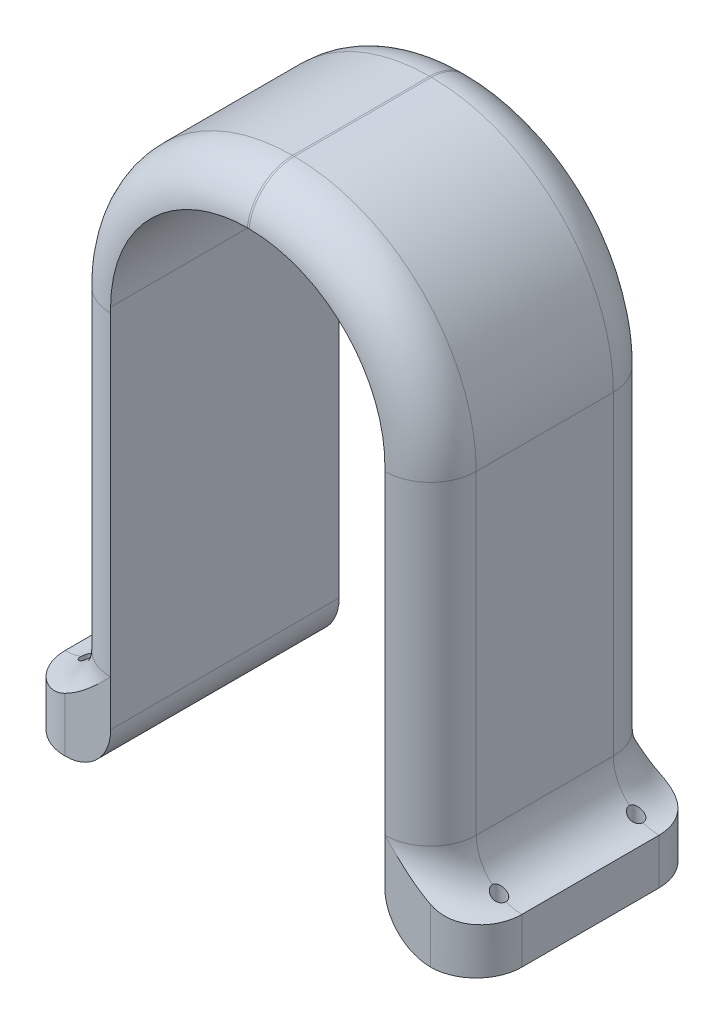
from build123d import *

# Parameters (mm, degrees)
BOSS_EXTRUDE2_DEPTH = 50
SKETCH3_R           = 1.5
SKETCH3_R_2         = 1.5000000000000002
SKETCH3_R_3         = 1.4999999999999973
CUT_EXTRUDE1_DEPTH  = 50
FILLET2_R           = 10
FILLET3_R           = 10
FILLET8_R           = 10
FILLET12_R          = 10
FILLET13_R          = 10
FILLET14_R          = 10
FILLET15_R          = 10
FILLET16_R          = 10
FILLET19_R          = 10


# Some blends are built 0.0001 mm under size
with BuildPart() as part:
    # Sketch1 → Boss-Extrude2 (new body)
    with BuildSketch(Plane.XY):
        with BuildLine():
            Line((-7.452830188679244, -1.2358490566037745), (-7.452830188679242, -11.235849056603774))
            Line((-7.452830188679242, -11.235849056603774), (12.547169811320757, -11.235849056603774))
            Line((12.547169811320757, -11.235849056603774), (12.547169811320757, 78.86415094339623))
            ThreePointArc((12.547169811320757, 78.86415094339623), (21.304677053842983, 100.00664370087401), (42.447169811320755, 108.76415094339623))
            Line((42.447169811320755, 108.76415094339623), (42.647169811320765, 108.76415094339623))
            ThreePointArc((42.647169811320765, 108.76415094339623), (63.78966256879854, 100.00664370087402), (72.54716981132077, 78.86415094339624))
            Line((72.54716981132077, 78.86415094339624), (72.54716981132076, -11.235849056603778))
            Line((72.54716981132076, -11.235849056603778), (92.54716981132076, -11.235849056603774))
            Line((92.54716981132076, -11.235849056603774), (92.54716981132076, -1.2358490566037745))
            Line((92.54716981132076, -1.2358490566037745), (82.54716981132077, -1.2358490566037745))
            Line((82.54716981132077, -1.2358490566037745), (82.54716981132077, 77.70413150101334))
            ThreePointArc((82.54716981132077, 77.70413150101334), (70.89001970254536, 105.84698139223794), (42.74716981132076, 117.50413150101335))
            Line((42.74716981132076, 117.50413150101335), (42.34716981132076, 117.50413150101332))
            ThreePointArc((42.34716981132076, 117.50413150101332), (14.204319920096182, 105.84698139223792), (2.5471698113207557, 77.70413150101334))
            Line((2.5471698113207557, 77.70413150101334), (2.5471698113207566, -1.2358490566037745))
            Line((2.5471698113207566, -1.2358490566037745), (-7.452830188679244, -1.2358490566037745))
        make_face()
    extrude(amount=BOSS_EXTRUDE2_DEPTH)

    # Sketch3 → Cut-Extrude1 (cut)
    with BuildSketch(Plane(origin=(0, -1.2358490566037745, 0), x_dir=(1, 0, 0), z_dir=(0, 1, 0))):
        with Locations(Location((-2.4528301886792443, -40, 0), (0, 0, 270))):
            Circle(SKETCH3_R)
        with Locations(Location((-2.452830188679243, -9.999999999999998, 0), (0, 0, 270))):
            Circle(SKETCH3_R_2)
        with Locations(Location((87.54716981132077, -9.999999999999998, 0), (0, 0, 270))):
            Circle(SKETCH3_R_3)
        with Locations(Location((87.54716981132077, -40, 0), (0, 0, 270))):
            Circle(SKETCH3_R_3)
    extrude(amount=-CUT_EXTRUDE1_DEPTH, mode=Mode.SUBTRACT)

    # Fillet2
    fillet2_edges = [part.edges().sort_by_distance(p)[0] for p in [
        (12.547169811320757, -11.235849056603774, 25),
    ]]
    fillet(fillet2_edges, radius=FILLET2_R)

    # Fillet3
    fillet3_edges = [part.edges().sort_by_distance(p)[0] for p in [
        (72.54716981132076, -11.235849056603778, 25),
    ]]
    fillet(fillet3_edges, radius=FILLET3_R)

    # Fillet8
    # the kernel refuses this fillet: 10 mm, written as the material it takes off along each edge
    with BuildSketch(Plane(origin=(82.54716981132077, -1.2358490566037745, 50), x_dir=(0, 0, -1), z_dir=(0, 1, 0))) as fillet8_piece_1:
        with BuildLine():
            CenterArc((FILLET8_R, FILLET8_R), FILLET8_R, 180, 90)
            Line((0, FILLET8_R), (0, 0))
            Line((0, 0), (FILLET8_R, 0))
        make_face()
    extrude(amount=78.9399805576171, mode=Mode.SUBTRACT)
    with BuildSketch(Plane(origin=(2.5471698113207557, 77.70413150101334, 50), x_dir=(9e-17, 0, -1), z_dir=(1e-17, -1, 0))) as fillet8_piece_2:
        with BuildLine():
            CenterArc((FILLET8_R, FILLET8_R), FILLET8_R, 180, 90)
            Line((8.9e-16, FILLET8_R), (0, 0))
            Line((0, 0), (FILLET8_R, 0))
        make_face()
    extrude(amount=78.9399805576171, mode=Mode.SUBTRACT)
    with BuildSketch(Plane(origin=(42.34716981132078, 77.70413150101331, 50), x_dir=(-5.4e-16, 1, 0), z_dir=(1, 5.4e-16, 0))) as fillet8_piece_3:
        with BuildLine():
            CenterArc((39.80000000000001 - FILLET8_R, -FILLET8_R), FILLET8_R, 0, 90)
            Line((39.80000000000001 - FILLET8_R, 0), (39.80000000000001, 0))
            Line((39.80000000000001, 0), (39.80000000000001, -FILLET8_R))
        make_face()
    revolve(axis=Axis((42.34716981132078, 77.70413150101331, 50), (0, 0, 1)), revolution_arc=89.99999999999993, mode=Mode.SUBTRACT)
    with BuildSketch(Plane(origin=(82.54716981132077, -1.2358490566037745, 0), x_dir=(-1, 0, 0), z_dir=(0, 1, 0))) as fillet8_piece_4:
        with BuildLine():
            CenterArc((FILLET8_R, FILLET8_R), FILLET8_R, 180, 90)
            Line((0, FILLET8_R), (0, 0))
            Line((0, 0), (FILLET8_R, 0))
        make_face()
    extrude(amount=78.9399805576171, mode=Mode.SUBTRACT)
    with BuildSketch(Plane(origin=(2.5471698113207557, 77.70413150101334, 0), x_dir=(1, 1e-17, 0), z_dir=(1e-17, -1, 0))) as fillet8_piece_5:
        with BuildLine():
            CenterArc((FILLET8_R, FILLET8_R), FILLET8_R, 180, 90)
            Line((-2.66e-15, FILLET8_R), (0, 0))
            Line((0, 0), (FILLET8_R, 0))
        make_face()
    extrude(amount=78.9399805576171, mode=Mode.SUBTRACT)
    with BuildSketch(Plane(origin=(42.34716981132078, 77.70413150101331, 0), x_dir=(-5.4e-16, 1, 0), z_dir=(1, 5.4e-16, 0))) as fillet8_piece_6:
        with BuildLine():
            CenterArc((39.80000000000001 - FILLET8_R, FILLET8_R), FILLET8_R, 270, 89.99999999999999)
            Line((39.80000000000001, FILLET8_R), (39.80000000000001, 0))
            Line((39.80000000000001, 0), (39.80000000000001 - FILLET8_R, 0))
        make_face()
    revolve(axis=Axis((42.34716981132078, 77.70413150101331, 0), (0, 0, 1)), revolution_arc=89.99999999999993, mode=Mode.SUBTRACT)
    with BuildSketch(Plane(origin=(42.74716981132076, 77.70413150101334, 50), x_dir=(1, 0, 0), z_dir=(0, -1, 0))) as fillet8_piece_7:
        with BuildLine():
            CenterArc((39.80000000000001 - FILLET8_R, -FILLET8_R), FILLET8_R, 0, 90)
            Line((39.80000000000001 - FILLET8_R, 0), (39.80000000000001, 0))
            Line((39.80000000000001, 0), (39.80000000000001, -FILLET8_R))
        make_face()
    revolve(axis=Axis((42.74716981132076, 77.70413150101334, 50), (0, 0, 1)), revolution_arc=90, mode=Mode.SUBTRACT)
    with BuildSketch(Plane(origin=(42.74716981132076, 77.70413150101334, 0), x_dir=(1, 0, 0), z_dir=(0, -1, 0))) as fillet8_piece_8:
        with BuildLine():
            CenterArc((39.80000000000001 - FILLET8_R, FILLET8_R), FILLET8_R, 270, 89.99999999999999)
            Line((39.80000000000001, FILLET8_R), (39.80000000000001, 0))
            Line((39.80000000000001, 0), (39.80000000000001 - FILLET8_R, 0))
        make_face()
    revolve(axis=Axis((42.74716981132076, 77.70413150101334, 0), (0, 0, 1)), revolution_arc=90, mode=Mode.SUBTRACT)
    with BuildSketch(Plane(origin=(42.74716981132076, 117.50413150101335, 0), x_dir=(7.105e-14, -1, 0), z_dir=(-1, -7.105e-14, 0))) as fillet8_piece_9:
        with BuildLine():
            CenterArc((FILLET8_R, FILLET8_R), FILLET8_R, 180, 90)
            Line((0, FILLET8_R), (0, 0))
            Line((0, 0), (FILLET8_R, 0))
        make_face()
    extrude(amount=0.3999999999999986, mode=Mode.SUBTRACT)
    with BuildSketch(Plane(origin=(42.74716981132076, 117.50413150101335, 50), x_dir=(0, 0, -1), z_dir=(-1, -7.105e-14, 0))) as fillet8_piece_10:
        with BuildLine():
            CenterArc((FILLET8_R, FILLET8_R), FILLET8_R, 180, 90)
            Line((0, FILLET8_R), (0, 0))
            Line((0, 0), (FILLET8_R, 0))
        make_face()
    extrude(amount=0.3999999999999986, mode=Mode.SUBTRACT)

    # Fillet12
    # the kernel refuses this fillet: 10 mm, written as the material it adds along each edge
    with BuildSketch(Plane(origin=(72.547169811321, -1.235849056604, 10), x_dir=(1, 0, 1.8e-16), z_dir=(-1.8e-16, 0, 1))) as fillet12_piece_1_section:
        with BuildLine():
            CenterArc((10 + FILLET12_R, FILLET12_R), FILLET12_R, 180, 90)
            Line((10 + FILLET12_R, -1.55e-15), (10, 0))
            Line((10, 0), (10, FILLET12_R))
        make_face()
    fillet12_piece_1 = revolve(axis=Axis((72.547169811321, -1.235849056604, 10), (0, 1, 0)), revolution_arc=90, mode=Mode.PRIVATE)
    fillet12_piece_1 = split(fillet12_piece_1, bisect_by=Plane(origin=(75.00369430910867, 6.370618904559798, 0), z_dir=(0, 0, 1)), keep=Keep.TOP, mode=Mode.PRIVATE)
    fillet12_piece_1 = fillet12_piece_1 - Plane(origin=(87.54716981132077, 6.370618904559796, 9.999999999999998), x_dir=(-1.8e-16, 0, 1), z_dir=(0, 1, 0)) * Cylinder(1.4999999999999973, 80, mode=Mode.PRIVATE)
    add(fillet12_piece_1)
    with BuildSketch(Plane(origin=(82.54716981132077, -1.2358490566037745, 10), x_dir=(0, 1, 0), z_dir=(0, 0, 1))) as fillet12_piece_2_section:
        with BuildLine():
            CenterArc((FILLET12_R, -FILLET12_R), FILLET12_R, 90, 90)
            Line((-1.33e-15, -FILLET12_R), (0, 0))
            Line((0, 0), (FILLET12_R, 0))
        make_face()
    fillet12_piece_2 = extrude(amount=30, mode=Mode.PRIVATE)
    fillet12_piece_2 = fillet12_piece_2 - Plane(origin=(87.54716981132077, 1.0205377803121847, 40), x_dir=(-1.8e-16, 0, 1), z_dir=(0, 1, 0)) * Cylinder(1.4999999999999973, 100, mode=Mode.PRIVATE)
    fillet12_piece_2 = fillet12_piece_2 - Plane(origin=(87.54716981132077, 1.0205377803121847, 9.999999999999998), x_dir=(-1.8e-16, 0, 1), z_dir=(0, 1, 0)) * Cylinder(1.4999999999999973, 100, mode=Mode.PRIVATE)
    add(fillet12_piece_2)
    with BuildSketch(Plane(origin=(72.547169811321, -1.235849056604, 40), x_dir=(0, 0, 1), z_dir=(-1, 0, 0))) as fillet12_piece_3_section:
        with BuildLine():
            CenterArc((10 + FILLET12_R, FILLET12_R), FILLET12_R, 180, 90)
            Line((10 + FILLET12_R, -1.55e-15), (10, 0))
            Line((10, 0), (10, FILLET12_R))
        make_face()
    fillet12_piece_3 = revolve(axis=Axis((72.547169811321, -1.235849056604, 40), (0, 1, 0)), revolution_arc=90, mode=Mode.PRIVATE)
    fillet12_piece_3 = split(fillet12_piece_3, bisect_by=Plane(origin=(75.00426840163993, 6.370343731696096, 50), z_dir=(0, 0, -1)), keep=Keep.TOP, mode=Mode.PRIVATE)
    fillet12_piece_3 = fillet12_piece_3 - Plane(origin=(87.54716981132077, 6.370343731696099, 40), x_dir=(-1.8e-16, 0, 1), z_dir=(0, 1, 0)) * Cylinder(1.4999999999999973, 80, mode=Mode.PRIVATE)
    add(fillet12_piece_3)

    # Fillet13
    # the kernel refuses this fillet: 10 mm, written as the material it adds along each edge
    with BuildSketch(Plane(origin=(12.547169811321, -1.2358490566040103, 10), x_dir=(-1, 0, 1.8e-16), z_dir=(1.8e-16, 0, 1))) as fillet13_piece_1_section:
        with BuildLine():
            CenterArc((10 + FILLET13_R, -FILLET13_R), FILLET13_R, 90, 90)
            Line((10 + FILLET13_R, 0), (10, 0))
            Line((10, 0), (10, -FILLET13_R))
        make_face()
    fillet13_piece_1 = revolve(axis=Axis((12.547169811321, -1.2358490566040103, 10), (0, -1, 0)), revolution_arc=90, mode=Mode.PRIVATE)
    fillet13_piece_1 = split(fillet13_piece_1, bisect_by=Plane(origin=(10.086939515151748, 6.369976518632988, 0), z_dir=(0, 0, 1)), keep=Keep.TOP, mode=Mode.PRIVATE)
    fillet13_piece_1 = fillet13_piece_1 - Plane(origin=(-2.452830188679243, 6.369976518632987, 9.999999999999998), x_dir=(-1.8e-16, 0, 1), z_dir=(0, 1, 0)) * Cylinder(1.5000000000000002, 80, mode=Mode.PRIVATE)
    add(fillet13_piece_1)
    with BuildSketch(Plane(origin=(2.5471698113207566, -1.2358490566037745, 10), x_dir=(0, 1, 0), z_dir=(0, 0, 1))) as fillet13_piece_2_section:
        with BuildLine():
            CenterArc((FILLET13_R, FILLET13_R), FILLET13_R, 180, 90)
            Line((5.77e-15, FILLET13_R), (0, 0))
            Line((0, 0), (FILLET13_R, 0))
        make_face()
    fillet13_piece_2 = extrude(amount=30, mode=Mode.PRIVATE)
    fillet13_piece_2 = fillet13_piece_2 - Plane(origin=(-2.452830188679243, 1.0205357835469981, 9.999999999999998), x_dir=(-1.8e-16, 0, 1), z_dir=(0, 1, 0)) * Cylinder(1.5000000000000002, 101, mode=Mode.PRIVATE)
    fillet13_piece_2 = fillet13_piece_2 - Plane(origin=(-2.4528301886792443, 1.0205357835469981, 40), x_dir=(-1.8e-16, 0, 1), z_dir=(0, 1, 0)) * Cylinder(1.5, 101, mode=Mode.PRIVATE)
    add(fillet13_piece_2)
    with BuildSketch(Plane(origin=(12.547169811321, -1.2358490566040103, 40), x_dir=(1.8e-16, 0, 1), z_dir=(1, 0, -1.8e-16))) as fillet13_piece_3_section:
        with BuildLine():
            CenterArc((10 + FILLET13_R, -FILLET13_R), FILLET13_R, 90, 90)
            Line((10 + FILLET13_R, 0), (10, 0))
            Line((10, 0), (10, -FILLET13_R))
        make_face()
    fillet13_piece_3 = revolve(axis=Axis((12.547169811321, -1.2358490566040103, 40), (0, -1, 0)), revolution_arc=90, mode=Mode.PRIVATE)
    fillet13_piece_3 = split(fillet13_piece_3, bisect_by=Plane(origin=(10.090045594629608, 6.369834872579503, 50), z_dir=(0, 0, -1)), keep=Keep.TOP, mode=Mode.PRIVATE)
    fillet13_piece_3 = fillet13_piece_3 - Plane(origin=(-2.4528301886792443, 6.369834872579503, 40), x_dir=(-1.8e-16, 0, 1), z_dir=(0, 1, 0)) * Cylinder(1.5, 80, mode=Mode.PRIVATE)
    add(fillet13_piece_3)

    # Fillet14
    fillet14_edges = [part.edges().sort_by_distance(p)[0] for p in [
        (-7.452830188679243, -6.235849056603774, 50),
    ]]
    fillet(fillet14_edges, radius=FILLET14_R)

    # Fillet15
    fillet15_edges = [part.edges().sort_by_distance(p)[0] for p in [
        (92.54716981132076, -6.235849056603774, 50),
    ]]
    fillet(fillet15_edges, radius=FILLET15_R - 0.0001)  # a hair under: the kernel refuses the full size

    # Fillet16
    # the kernel refuses this fillet: 10 mm, written as the material it takes off along each edge
    with BuildSketch(Plane(origin=(92.54716981132076, -36.235849056603776, 0), x_dir=(0, 0, 1), z_dir=(0, 1, 0))) as fillet16_piece_1:
        with BuildLine():
            CenterArc((FILLET16_R, -FILLET16_R), FILLET16_R, 90, 90)
            Line((-1.78e-15, -FILLET16_R), (0, 0))
            Line((0, 0), (FILLET16_R, 0))
        make_face()
    extrude(amount=60, mode=Mode.SUBTRACT)

    # Fillet19
    # the kernel refuses this fillet: 10 mm, written as the material it takes off along each edge
    with BuildSketch(Plane(origin=(-7.4528301886792505, 23.76415094339622, 0), x_dir=(1, 2.7e-16, 0), z_dir=(2.7e-16, -1, 0))) as fillet19_piece_1:
        with BuildLine():
            CenterArc((FILLET19_R, FILLET19_R), FILLET19_R, 180, 90)
            Line((-1.78e-15, FILLET19_R), (0, 0))
            Line((0, 0), (FILLET19_R, 0))
        make_face()
    extrude(amount=59.999999999999986, mode=Mode.SUBTRACT)


solid = part.part
